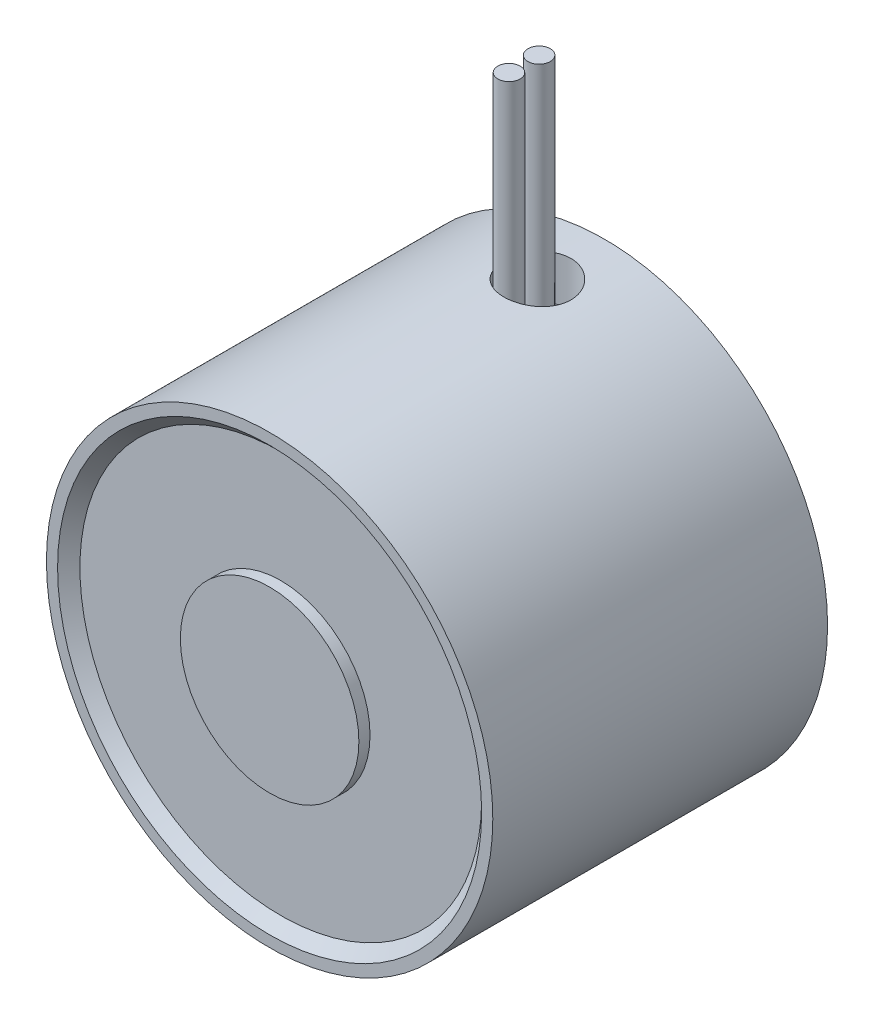
from build123d import *

# Parameters (mm, degrees)
SKETCH_1_R          = 10
EXTRUDE_1_DEPTH     = 15
SKETCH_2_R          = 9
SKETCH_2_R_2        = 4
CUT_EXTRUDE_2_DEPTH = 0.5
CHAMFER_1_SIZE      = 0.5
SKETCH_3_R          = 1.5
CUT_EXTRUDE_3_DEPTH = 5
CHAMFER_2_SIZE      = 0.5
SKETCH_4_R          = 1.5
CUT_EXTRUDE_4_DEPTH = 7
SKETCH_5_R          = 0.5
EXTRUDE_2_DEPTH     = 10


with BuildPart() as part:
    # 草图1 → 凸台-拉伸1 (new body)
    with BuildSketch(Plane.XY):
        Circle(SKETCH_1_R)
    extrude(amount=EXTRUDE_1_DEPTH)

    # 草图2 → 切除-拉伸2 (cut)
    with BuildSketch(Plane.XY.offset(15)):
        Circle(SKETCH_2_R)
        Circle(SKETCH_2_R_2, mode=Mode.SUBTRACT)
    extrude(amount=-CUT_EXTRUDE_2_DEPTH, mode=Mode.SUBTRACT)

    # 倒角1
    chamfer_1_edges = [part.edges().sort_by_distance(p)[0] for p in [
        (-9, 0, 15),
    ]]
    chamfer(chamfer_1_edges, length=CHAMFER_1_SIZE - 0.0001)  # a hair under: the kernel refuses the full size

    # 草图3 → 切除-拉伸3 (cut)
    with BuildSketch(Plane(origin=(0, 0, 0), x_dir=(-1, 0, 0), z_dir=(0, 0, -1))):
        Circle(SKETCH_3_R)
    extrude(amount=-CUT_EXTRUDE_3_DEPTH, mode=Mode.SUBTRACT)

    # 倒角2
    chamfer_2_edges = [part.edges().sort_by_distance(p)[0] for p in [
        (1.5, 0, 0),
    ]]
    chamfer(chamfer_2_edges, length=CHAMFER_2_SIZE)

    # 草图4 → 切除-拉伸4 (cut)
    with BuildSketch(Plane(origin=(0, 8, 0), x_dir=(1, 0, 0), z_dir=(0, 1, 0))):
        with Locations(Location((0, -3, 0), (0, 0, 90))):
            Circle(SKETCH_4_R)
    extrude(amount=CUT_EXTRUDE_4_DEPTH, mode=Mode.SUBTRACT)

    # 草图5 → 凸台-拉伸2 (add)
    with BuildSketch(Plane(origin=(0, 8, 0), x_dir=(1, 0, 0), z_dir=(0, 1, 0))):
        with Locations(Location((-0.6, -2.325227292, 0), (0, 0, 270))):
            Circle(SKETCH_5_R)
        with Locations(Location((-0.6, -3.674772708, 0), (0, 0, 270))):
            Circle(SKETCH_5_R)
    extrude(amount=EXTRUDE_2_DEPTH)


solid = part.part
